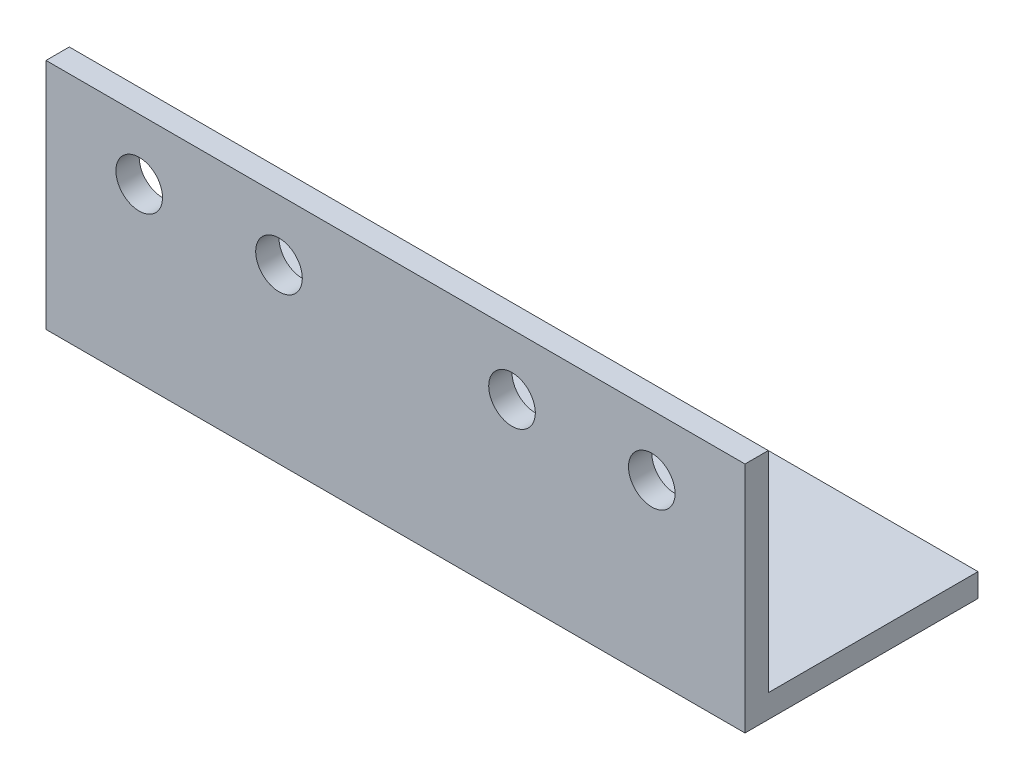
from build123d import *

# Parameters (mm, degrees)
EXTRUDE_1_DEPTH     = 150
SKETCH_2_R          = 5
CUT_EXTRUDE_1_DEPTH = 166.831239518
SKETCH_3_R          = 5
CUT_EXTRUDE_2_DEPTH = 166.831239518


with BuildPart() as part:
    # Эскиз1 → Вытянуть-Тонкостенный1 (new body)
    with BuildSketch(Plane(origin=(0, 0, 0), x_dir=(0, 0, -1), z_dir=(1, 0, 0))):
        Polygon((50, 0), (0, 0), (0, 50), (5, 50), (5, 5), (50, 5), align=None)
    extrude(amount=EXTRUDE_1_DEPTH)

    # Эскиз2 → Вырез-Вытянуть1 (cut, through all)
    with BuildSketch(Plane.XY):
        with Locations((20, 37)):
            Circle(SKETCH_2_R)
        with Locations((50, 37)):
            Circle(SKETCH_2_R)
        with Locations((100, 37)):
            Circle(SKETCH_2_R)
        with Locations((130, 37)):
            Circle(SKETCH_2_R)
    extrude(amount=-CUT_EXTRUDE_1_DEPTH, mode=Mode.SUBTRACT)

    # Эскиз3 → Вырез-Вытянуть2 (cut, through all)
    with BuildSketch(Plane.XZ):
        with Locations((130, -18)):
            Circle(SKETCH_3_R)
        with Locations((100, -18)):
            Circle(SKETCH_3_R)
        with Locations((50, -18)):
            Circle(SKETCH_3_R)
        with Locations((20, -18)):
            Circle(SKETCH_3_R)
    extrude(amount=-CUT_EXTRUDE_2_DEPTH, mode=Mode.SUBTRACT)


solid = part.part
